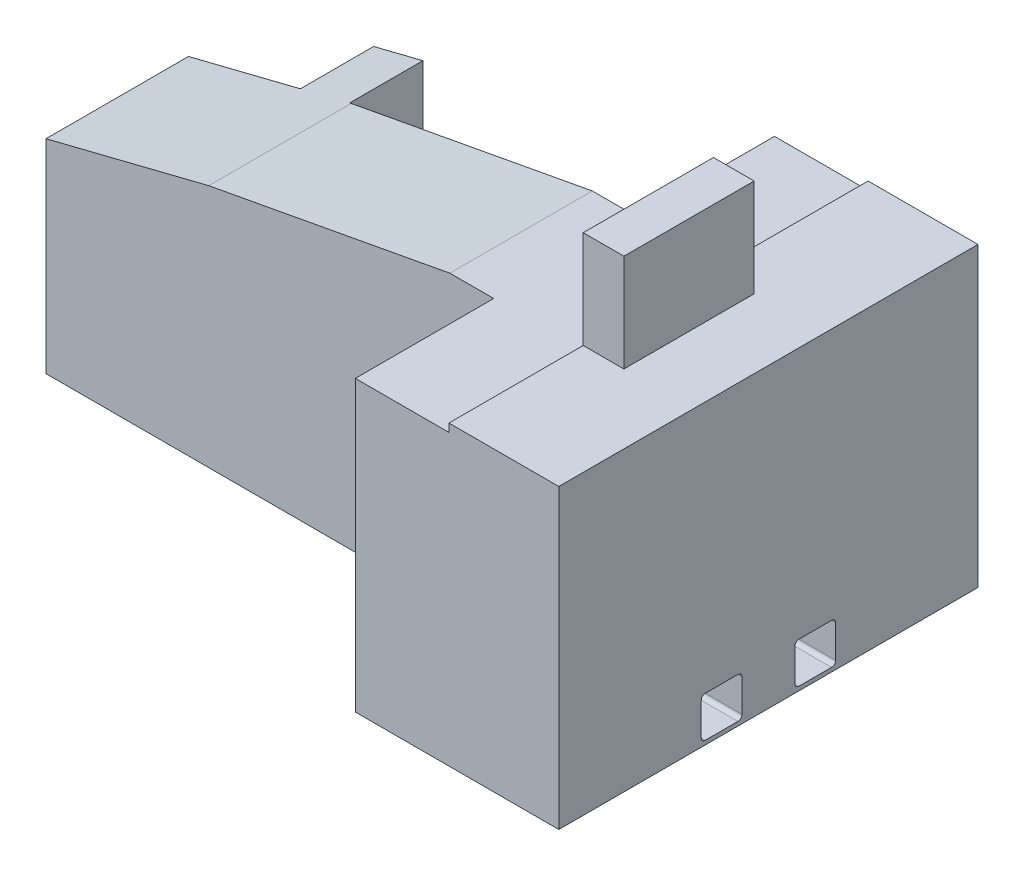
from build123d import *

# Parameters (mm, degrees)
BOSS_EXTRUDE1_DEPTH     = 970
CUT_EXTRUDE1_DEPTH      = 1359.721825835
CUT_EXTRUDE1_DEPTH_BACK = 1359.721825835
CUT_EXTRUDE5_DEPTH      = 1625
SKETCH4_R               = 8.5
CUT_EXTRUDE6_DEPTH      = 78
SKETCH5_W               = 170
SKETCH5_H               = 240
SKETCH5_W_2             = 375
SKETCH5_H_2             = 260
CUT_EXTRUDE8_DEPTH      = 1478
SKETCH6_OUTSIDE_W       = 2029.168
SKETCH6_OUTSIDE_H       = 1459.168
SKETCH6_OUTSIDE_W_2     = 100
SKETCH6_OUTSIDE_H_2     = 320
CUT_EXTRUDE9_DEPTH      = 240


with BuildPart() as part:
    # Sketch2 → Boss-Extrude1 (new body)
    with BuildSketch(Plane(origin=(0, 0, 0), x_dir=(1, 0, 0), z_dir=(0, 1, 0))):
        Polygon((300, -515), (800, -515), (800, 515), (300, 515), (300, 175), (-404, 175), (-404, 355), (-525, 355), (-525, 175), (-800, 175), (-800, -175), (300, -175), align=None)
    extrude(amount=BOSS_EXTRUDE1_DEPTH)

    # Sketch1 → Cut-Extrude1 (cut, two sides: drawn at the far end of the back side and taken through both)
    with BuildSketch(Plane.XY.offset(-CUT_EXTRUDE1_DEPTH_BACK)):
        Polygon((-800, 970), (-800, 500), (-400, 600), (300, 730), (530, 970), align=None)
    extrude(amount=CUT_EXTRUDE1_DEPTH + CUT_EXTRUDE1_DEPTH_BACK, mode=Mode.SUBTRACT)

    # Sketch3 → Cut-Extrude5 (cut)
    with BuildSketch(Plane.ZY.offset(800)):
        with BuildLine():
            ThreePointArc((-155, 110), (-162.071067812, 107.071067812), (-165, 100))
            Line((-165, 100), (-165, 20))
            ThreePointArc((-165, 20), (-162.071067812, 12.928932188), (-155, 10))
            Line((-155, 10), (-75, 10))
            ThreePointArc((-75, 10), (-67.928932188, 12.928932188), (-65, 20))
            Line((-65, 20), (-65, 100))
            ThreePointArc((-65, 100), (-67.928932188, 107.071067812), (-75, 110))
            Line((-75, 110), (-155, 110))
        make_face()
        with BuildLine():
            Line((155, 110), (75, 110))
            ThreePointArc((75, 110), (67.928932188, 107.071067812), (65, 100))
            Line((65, 100), (65, 20))
            ThreePointArc((65, 20), (67.928932188, 12.928932188), (75, 10))
            Line((75, 10), (155, 10))
            ThreePointArc((155, 10), (162.071067812, 12.928932188), (165, 20))
            Line((165, 20), (165, 100))
            ThreePointArc((165, 100), (162.071067812, 107.071067812), (155, 110))
        make_face()
    extrude(amount=-CUT_EXTRUDE5_DEPTH, mode=Mode.SUBTRACT)

    # Sketch4 → Cut-Extrude6 (cut)
    with BuildSketch(Plane.XZ):
        with Locations((-498.5, 115)):
            Circle(SKETCH4_R)
        with Locations((-501, -115)):
            Circle(SKETCH4_R)
        with Locations((501, -115)):
            Circle(SKETCH4_R)
        with Locations((498.5, 115)):
            Circle(SKETCH4_R)
    extrude(amount=-CUT_EXTRUDE6_DEPTH, mode=Mode.SUBTRACT)

    # Sketch5 → Cut-Extrude8 (cut)
    with BuildSketch(Plane.XY.offset(515)):
        with Locations((715, 850)):
            Rectangle(SKETCH5_W, SKETCH5_H)
        with Locations((342.5, 840)):
            Rectangle(SKETCH5_W_2, SKETCH5_H_2)
    extrude(amount=-CUT_EXTRUDE8_DEPTH, mode=Mode.SUBTRACT)

    # Sketch6 outside → Cut-Extrude9 (cut)
    with BuildSketch(Plane(origin=(0, 970, 0), x_dir=(1, 0, 0), z_dir=(0, 1, 0))):
        Rectangle(SKETCH6_OUTSIDE_W, SKETCH6_OUTSIDE_H)
        with Locations((580, -25)):
            Rectangle(SKETCH6_OUTSIDE_W_2, SKETCH6_OUTSIDE_H_2, mode=Mode.SUBTRACT)
    extrude(amount=-CUT_EXTRUDE9_DEPTH, mode=Mode.SUBTRACT)


solid = part.part
